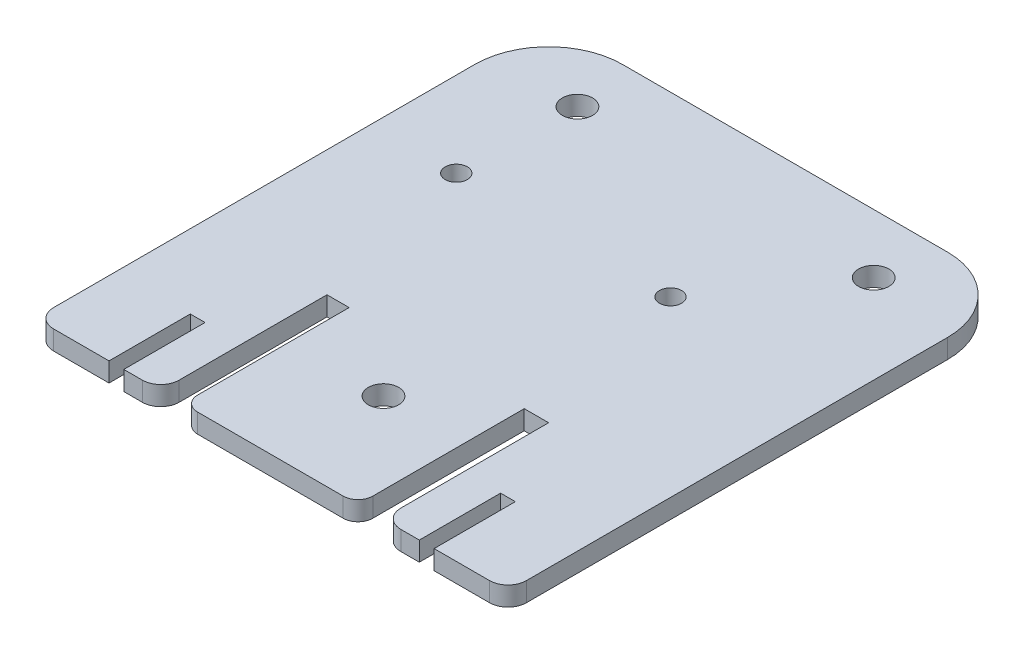
from build123d import *

# Parameters (mm, degrees)
MAIN_BODY_DEPTH          = 2.6
SCREW_HOLES_DEPTH        = 57.095989161
SCREW_HOLES_DEPTH_BACK   = 57.095989161
SKETCH2_R                = 2.05
SKETCH2_R_2              = 1.5
MAIN_LOWER_BODY_FILLET_R = 2
SKETCH5_W                = 17
SKETCH5_H                = 2.6
BOSS_EXTRUDE1_DEPTH      = 22.5
SKETCH6_W                = 2
SKETCH6_H                = 11
CUT_EXTRUDE1_DEPTH       = 22.5
FILLET2_R                = 2.5


with BuildPart() as part:
    # Sketch1 → Main Body (new body)
    with BuildSketch(Plane(origin=(0, 0, 0), x_dir=(1, 0, 0), z_dir=(0, 1, 0))):
        with BuildLine():
            Line((11.7, -23.5), (32, -23.5))
            Line((32, -23.5), (32, 13.5))
            ThreePointArc((32, 13.5), (29.071067812, 20.571067812), (22, 23.5))
            Line((22, 23.5), (-22, 23.5))
            ThreePointArc((-22, 23.5), (-29.071067812, 20.571067812), (-32, 13.5))
            Line((-32, 13.5), (-32, -23.5))
            Line((-32, -23.5), (-12, -23.5))
            Line((-12, -23.5), (-12, -46))
            Line((-12, -46), (11.7, -46))
            Line((11.7, -46), (11.7, -23.5))
        make_face()
    extrude(amount=MAIN_BODY_DEPTH)

    # Sketch2 → Screw holes (cut, two sides: drawn at the far end of the back side and taken through both)
    with BuildSketch(Plane(origin=(0, 2.6, 0), x_dir=(1, 0, 0), z_dir=(0, 1, 0)).offset(-SCREW_HOLES_DEPTH_BACK)):
        with Locations((-20.1, 15.5)):
            Circle(SKETCH2_R)
        with Locations((20, 15.5)):
            Circle(SKETCH2_R)
        with Locations((-20.5, -0.5)):
            Circle(SKETCH2_R_2)
        with Locations((8.5, -0.5)):
            Circle(SKETCH2_R_2)
        with Locations((0.7, -31.55)):
            Circle(SKETCH2_R)
    extrude(amount=SCREW_HOLES_DEPTH + SCREW_HOLES_DEPTH_BACK, mode=Mode.SUBTRACT)

    # Main lower body Fillet
    main_lower_body_fillet_edges = [part.edges().sort_by_distance(p)[0] for p in [
        (11.7, 1.3, 46),
        (-12, 1.3, 46),
    ]]
    fillet(main_lower_body_fillet_edges, radius=MAIN_LOWER_BODY_FILLET_R)

    # Sketch5 → Boss-Extrude1 (add)
    with BuildSketch(Plane.XY.offset(23.5)):
        with Locations((-23.5, 1.3)):
            Rectangle(SKETCH5_W, SKETCH5_H)
        with Locations((23.5, 1.3)):
            Rectangle(SKETCH5_W, SKETCH5_H)
    extrude(amount=BOSS_EXTRUDE1_DEPTH)

    # Sketch6 → Cut-Extrude1 (cut)
    with BuildSketch(Plane(origin=(0, 2.6, 0), x_dir=(1, 0, 0), z_dir=(0, 1, 0))):
        with Locations((-21, -40.5)):
            Rectangle(SKETCH6_W, SKETCH6_H)
        with Locations((21, -40.5)):
            Rectangle(SKETCH6_W, SKETCH6_H)
    extrude(amount=-CUT_EXTRUDE1_DEPTH, mode=Mode.SUBTRACT)

    # Fillet2
    fillet2_edges = [part.edges().sort_by_distance(p)[0] for p in [
        (-32, 1.3, 46),
        (-15, 1.3, 46),
        (15, 1.3, 46),
        (32, 1.3, 46),
    ]]
    fillet(fillet2_edges, radius=FILLET2_R)


solid = part.part
